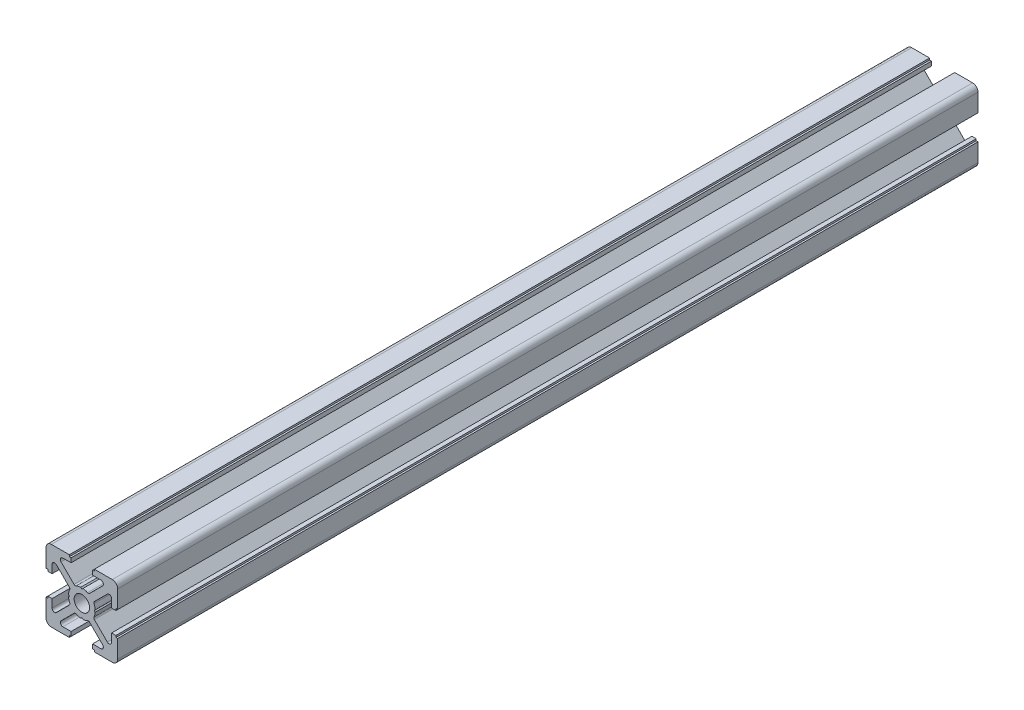
from build123d import *

# Parameters (mm, degrees)
SKETCH1_R           = 2.15
BOSS_EXTRUDE1_DEPTH = 240


# Read off the part's stored shape, not the designer's step: moBlkMgr[nhom 20x20x200]
with BuildPart() as part:
    # Sketch1 → Boss-Extrude1 (new body)
    with BuildSketch(Plane.XY.offset(308)):
        with BuildLine():
            Line((-3.499999948, -10), (-3.499999948, -9.5))
            Line((-3.499999948, -9.5), (-2.999999948, -9.5))
            Line((-2.999999948, -9.5), (-2.999999948, -8.299999968))
            Line((-2.999999948, -8.299999968), (-5.299390251, -8.299999968))
            ThreePointArc((-5.299390251, -8.299999968), (-5.946105923, -7.867878372), (-5.794365, -7.105025224))
            Line((-5.794365, -7.105025224), (-2.175465548, -3.48612574))
            ThreePointArc((-2.175465548, -3.48612574), (-1.907085057, -3.346986956), (-1.607569547, -3.387952169))
            ThreePointArc((-1.607569547, -3.387952169), (-0.96970891, -3.622452814), (-0.299999981, -3.73798071))
            Line((-0.299999981, -3.73798071), (1.9e-08, -3.449999972))
            Line((1.9e-08, -3.449999972), (0.300000019, -3.737980711))
            ThreePointArc((0.300000019, -3.737980711), (0.969708957, -3.622452812), (1.607569601, -3.387952162))
            ThreePointArc((1.607569601, -3.387952162), (1.90708511, -3.346986948), (2.175465602, -3.48612573))
            Line((2.175465602, -3.48612573), (5.794365085, -7.105025213))
            ThreePointArc((5.794365085, -7.105025213), (5.946106012, -7.867878368), (5.299390335, -8.299999968))
            Line((5.299390335, -8.299999968), (2.999999948, -8.299999968))
            Line((2.999999948, -8.299999968), (2.999999948, -9.5))
            Line((2.999999948, -9.5), (3.499999948, -9.5))
            Line((3.499999948, -9.5), (3.499999948, -10))
            Line((3.499999948, -10), (8.499999948, -10))
            ThreePointArc((8.499999948, -10), (9.56066012, -9.560660172), (9.999999948, -8.5))
            Line((9.999999948, -8.5), (9.999999948, -3.5))
            Line((9.999999948, -3.5), (9.499999948, -3.5))
            Line((9.499999948, -3.5), (9.499999948, -3))
            Line((9.499999948, -3), (8.299999976, -3))
            Line((8.299999976, -3), (8.299999976, -5.299390317))
            ThreePointArc((8.299999976, -5.299390317), (7.867878377, -5.94610599), (7.105025227, -5.794365061))
            Line((7.105025227, -5.794365061), (3.486125768, -2.17546557))
            ThreePointArc((3.486125768, -2.17546557), (3.346986986, -1.907085078), (3.387952202, -1.607569568))
            ThreePointArc((3.387952202, -1.607569568), (3.622452857, -0.969708918), (3.737980757, -0.299999973))
            Line((3.737980757, -0.299999973), (3.450000019, 2.8e-08))
            Line((3.450000019, 2.8e-08), (3.737980758, 0.300000028))
            ThreePointArc((3.737980758, 0.300000028), (3.622452857, 0.969708973), (3.387952202, 1.607569624))
            ThreePointArc((3.387952202, 1.607569624), (3.346986986, 1.907085133), (3.486125768, 2.175465626))
            Line((3.486125768, 2.175465626), (7.105025228, 5.794365118))
            ThreePointArc((7.105025228, 5.794365118), (7.867878378, 5.946106047), (8.299999976, 5.299390374))
            Line((8.299999976, 5.299390374), (8.299999976, 3))
            Line((8.299999976, 3), (9.499999948, 3))
            Line((9.499999948, 3), (9.499999948, 3.5))
            Line((9.499999948, 3.5), (9.999999948, 3.5))
            Line((9.999999948, 3.5), (9.999999948, 8.5))
            ThreePointArc((9.999999948, 8.5), (9.56066012, 9.560660172), (8.499999948, 10))
            Line((8.499999948, 10), (3.499999948, 10))
            Line((3.499999948, 10), (3.499999948, 9.5))
            Line((3.499999948, 9.5), (2.999999948, 9.5))
            Line((2.999999948, 9.5), (2.999999948, 8.300000024))
            Line((2.999999948, 8.300000024), (5.299390295, 8.300000024))
            ThreePointArc((5.299390295, 8.300000024), (5.946105965, 7.86787843), (5.794365042, 7.105025283))
            Line((5.794365042, 7.105025283), (2.175465586, 3.486125796))
            ThreePointArc((2.175465586, 3.486125796), (1.907085095, 3.346987012), (1.607569585, 3.387952225))
            ThreePointArc((1.607569585, 3.387952225), (0.969708948, 3.62245287), (0.300000018, 3.737980766))
            Line((0.300000018, 3.737980766), (1.9e-08, 3.450000028))
            Line((1.9e-08, 3.450000028), (-0.299999982, 3.737980766))
            ThreePointArc((-0.299999982, 3.737980766), (-0.969708911, 3.62245287), (-1.607569547, 3.387952225))
            ThreePointArc((-1.607569547, 3.387952225), (-1.907085057, 3.346987012), (-2.175465548, 3.486125796))
            Line((-2.175465548, 3.486125796), (-5.794365, 7.105025279))
            ThreePointArc((-5.794365, 7.105025279), (-5.946105923, 7.867878428), (-5.299390251, 8.300000024))
            Line((-5.299390251, 8.300000024), (-2.999999948, 8.300000024))
            Line((-2.999999948, 8.300000024), (-2.999999948, 9.5))
            Line((-2.999999948, 9.5), (-3.499999948, 9.5))
            Line((-3.499999948, 9.5), (-3.499999948, 10))
            Line((-3.499999948, 10), (-8.499999948, 10))
            ThreePointArc((-8.499999948, 10), (-9.56066012, 9.560660172), (-9.999999948, 8.5))
            Line((-9.999999948, 8.5), (-9.999999948, 3.5))
            Line((-9.999999948, 3.5), (-9.499999948, 3.5))
            Line((-9.499999948, 3.5), (-9.499999948, 3))
            Line((-9.499999948, 3), (-8.299999938, 3))
            Line((-8.299999938, 3), (-8.299999938, 5.299390329))
            ThreePointArc((-8.299999938, 5.299390329), (-7.867878344, 5.946105997), (-7.1050252, 5.794365072))
            Line((-7.1050252, 5.794365072), (-3.486125739, 2.175465611))
            ThreePointArc((-3.486125739, 2.175465611), (-3.346986957, 1.907085119), (-3.387952171, 1.607569609))
            ThreePointArc((-3.387952171, 1.607569609), (-3.622452821, 0.969708966), (-3.737980719, 0.300000029))
            Line((-3.737980719, 0.300000029), (-3.449999981, 2.8e-08))
            Line((-3.449999981, 2.8e-08), (-3.737980719, -0.299999971))
            ThreePointArc((-3.737980719, -0.299999971), (-3.622452819, -0.969708917), (-3.387952164, -1.607569568))
            ThreePointArc((-3.387952164, -1.607569568), (-3.346986948, -1.907085078), (-3.486125729, -2.17546557))
            Line((-3.486125729, -2.17546557), (-7.105025189, -5.794365061))
            ThreePointArc((-7.105025189, -5.794365061), (-7.867878339, -5.94610599), (-8.299999938, -5.299390317))
            Line((-8.299999938, -5.299390317), (-8.299999938, -3))
            Line((-8.299999938, -3), (-9.499999948, -3))
            Line((-9.499999948, -3), (-9.499999948, -3.5))
            Line((-9.499999948, -3.5), (-9.999999948, -3.5))
            Line((-9.999999948, -3.5), (-9.999999948, -8.5))
            ThreePointArc((-9.999999948, -8.5), (-9.56066012, -9.560660172), (-8.499999948, -10))
            Line((-8.499999948, -10), (-3.499999948, -10))
        make_face()
        with Locations(Location((1.9e-08, 2.8e-08, 0), (0, 0, 180))):
            Circle(SKETCH1_R, mode=Mode.SUBTRACT)
    extrude(amount=-BOSS_EXTRUDE1_DEPTH)


solid = part.part
